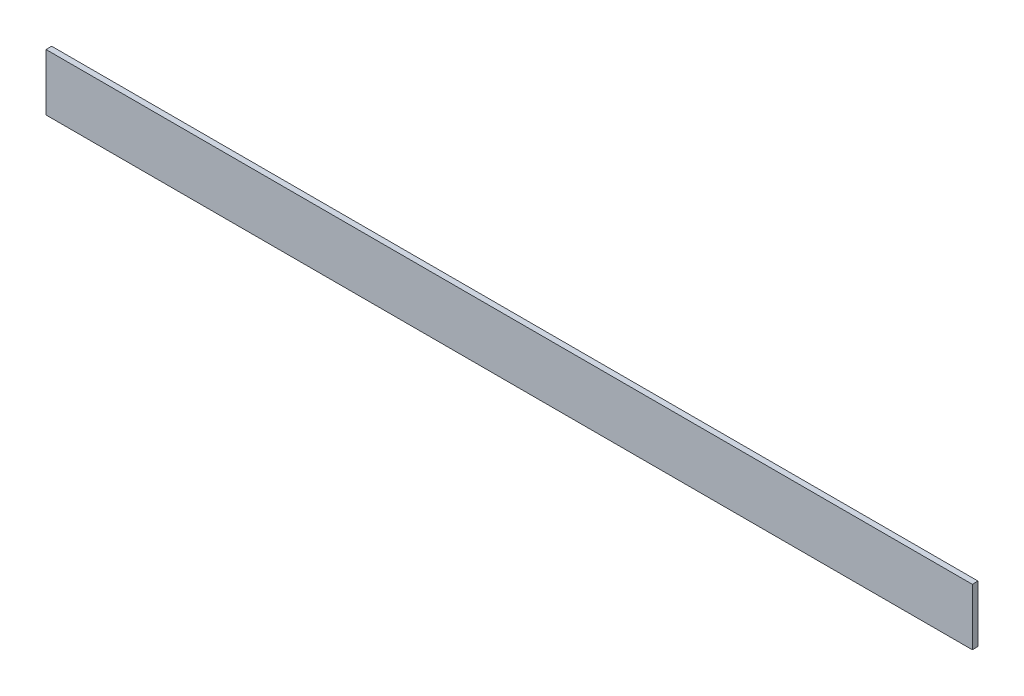
from build123d import *

# Parameters (mm, degrees)
EXTRUDE_1_DEPTH     = 490
SKETCH_2_W          = 27
SKETCH_2_H          = 27
CUT_EXTRUDE_1_DEPTH = 492.833305094


with BuildPart() as part:
    # Эскиз1 → Вытянуть-Тонкостенный1 (new body)
    with BuildSketch(Plane(origin=(0, 0, 0), x_dir=(0, 0, -1), z_dir=(1, 0, 0))):
        Polygon((0, 30), (0, 0), (30, 0), (30, 3), (3, 3), (3, 30), align=None)
    extrude(amount=EXTRUDE_1_DEPTH)

    # Эскиз2 → Вырез-Вытянуть1 (cut, through all)
    with BuildSketch(Plane.XZ):
        with Locations((13.5, -16.5)):
            Rectangle(SKETCH_2_W, SKETCH_2_H)
        with Locations((476.5, -16.5)):
            Rectangle(SKETCH_2_W, SKETCH_2_H)
    extrude(amount=-CUT_EXTRUDE_1_DEPTH, mode=Mode.SUBTRACT)


solid = part.part
